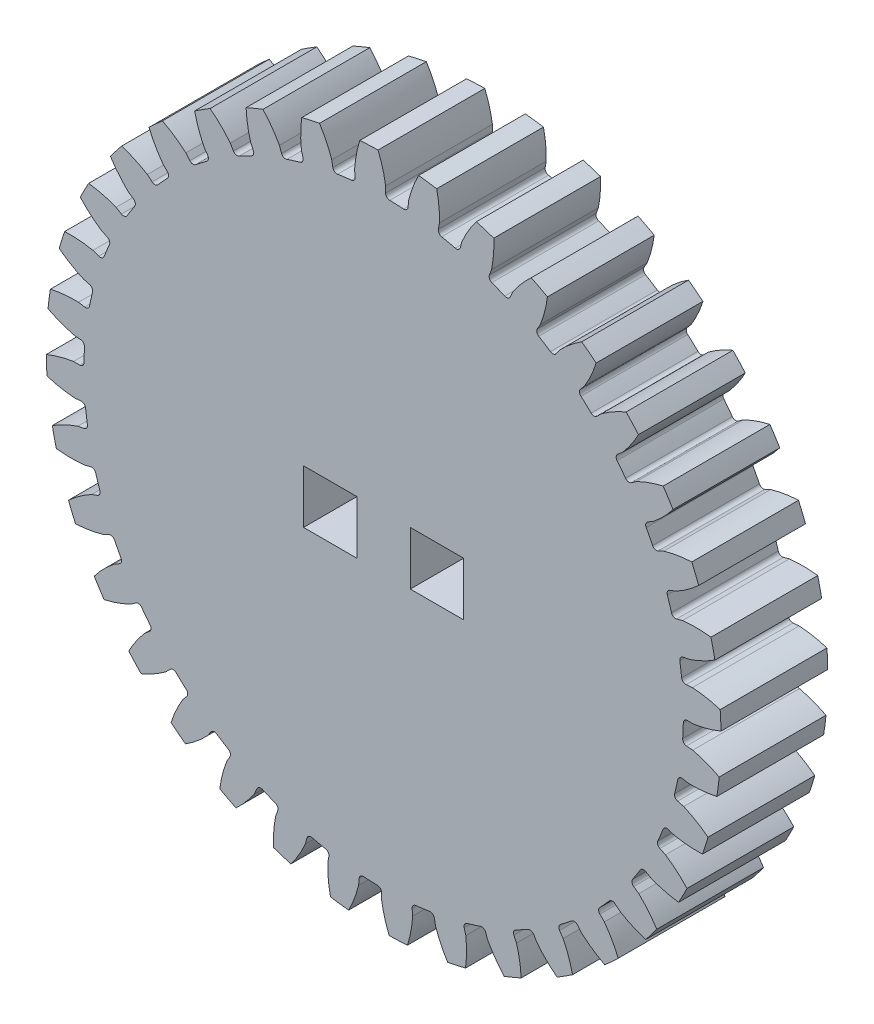
from build123d import *

# Parameters (mm, degrees)
SKETCH1_R                = 20.066
BOSS_EXTRUDE1_DEPTH      = 6.35
CUT_EXTRUDE1_DEPTH       = 30.079394973
FILLET1_R                = 0.2493645
CIRPATTERN1_COUNT        = 36
FILLET1_OF_CIRPATTERN1_R = 0.2493645
CUT_EXTRUDE2_DEPTH       = 30.07560404
CUT_EXTRUDE2_DEPTH_BACK  = 30.07560404
SKETCH6_W                = 3.175
SKETCH6_H                = 3.175


with BuildPart() as part:
    # Sketch1 → Boss-Extrude1 (new body)
    with BuildSketch(Plane.XY):
        Circle(SKETCH1_R)
    extrude(amount=-BOSS_EXTRUDE1_DEPTH)

    # Sketch4 → Cut-Extrude1 (cut, through all)
    with BuildSketch(Plane.XY):
        with BuildLine():
            Line((0.119863022, 18.442823048), (0.119863022, 17.825105335))
            ThreePointArc((0.119863022, 17.825105335), (0.77753957, 17.80854232), (1.434157013, 17.767721886))
            Line((1.434157013, 17.767721886), (1.487994785, 18.383088986))
            add(Edge.make_bspline(
                [(3.588260473, 21.933290983), (1.978189723, 20.400079012), (1.487994785, 18.383088986)],
                knots=[0, 0, 0, 1, 1, 1], degree=2))
            ThreePointArc((3.588260473, 21.933290983), (0.969437499, 22.2037172), (-1.662989269, 22.162566035))
            add(Edge.make_bspline(
                [(-1.662989269, 22.162566035), (-0.192673894, 20.494861186), (0.119863022, 18.442823048)],
                knots=[0, 0, 0, 1, 1, 1], degree=2))
        make_face()
    cut_extrude1 = extrude(amount=-CUT_EXTRUDE1_DEPTH, mode=Mode.SUBTRACT)

    # Fillet1
    fillet1_edges = [part.edges().sort_by_distance(p)[0] for p in [
        (1.434157013, 17.767721886, -3.175),
        (0.119863022, 17.825105335, -3.175),
    ]]
    fillet(fillet1_edges, radius=FILLET1_R)

    # CirPattern1: Cut-Extrude1 ×36 about axis
    cirpattern1_axis = Axis((0, 0, -6.35), (0, 0, 1))
    for i in range(1, CIRPATTERN1_COUNT):
        add(cut_extrude1.rotate(cirpattern1_axis, i * 360 / CIRPATTERN1_COUNT), mode=Mode.SUBTRACT)

    # Fillet1 of CirPattern1
    fillet1_of_cirpattern1_edges = [part.edges().sort_by_distance(p)[0] for p in [
        (-1.672963581, 17.746829018, -3.175),
        (-2.977255024, 17.575115927, -3.175),
        (-4.729252023, 17.186707731, -3.175),
        (-5.983910684, 16.791115516, -3.175),
        (-7.641844536, 16.104377027, -3.175),
        (-8.808748245, 15.496925556, -3.175),
        (-10.32224347, 14.532722976, -3.175),
        (-11.365936448, 13.731869355, -3.175),
        (-12.689006259, 12.519499491, -3.175),
        (-13.577776424, 11.549577253, -3.175),
        (-14.670220014, 10.125877349, -3.175),
        (-15.377062534, 9.01635709, -3.175),
        (-16.205686557, 7.424585548, -3.175),
        (-16.70912438, 6.209179479, -3.175),
        (-17.248751514, 4.497701473, -3.175),
        (-17.533487937, 3.213339092, -3.175),
        (-17.767721886, 1.434157013, -3.175),
        (-17.825105335, 0.119863022, -3.175),
        (-17.746829018, -1.672963581, -3.175),
        (-17.575115927, -2.977255024, -3.175),
        (-17.186707731, -4.729252023, -3.175),
        (-16.791115516, -5.983910684, -3.175),
        (-16.104377027, -7.641844536, -3.175),
        (-15.496925556, -8.808748245, -3.175),
        (-14.532722976, -10.32224347, -3.175),
        (-13.731869355, -11.365936448, -3.175),
        (-12.519499491, -12.689006259, -3.175),
        (-11.549577253, -13.577776424, -3.175),
        (-10.125877349, -14.670220014, -3.175),
        (-9.01635709, -15.377062534, -3.175),
        (-7.424585548, -16.205686557, -3.175),
        (-6.209179479, -16.70912438, -3.175),
        (-4.497701473, -17.248751514, -3.175),
        (-3.213339092, -17.533487937, -3.175),
        (-1.434157013, -17.767721886, -3.175),
        (-0.119863022, -17.825105335, -3.175),
        (1.672963581, -17.746829018, -3.175),
        (2.977255024, -17.575115927, -3.175),
        (4.729252023, -17.186707731, -3.175),
        (5.983910684, -16.791115516, -3.175),
        (7.641844536, -16.104377027, -3.175),
        (8.808748245, -15.496925556, -3.175),
        (10.32224347, -14.532722976, -3.175),
        (11.365936448, -13.731869355, -3.175),
        (12.689006259, -12.519499491, -3.175),
        (13.577776424, -11.549577253, -3.175),
        (14.670220014, -10.125877349, -3.175),
        (15.377062534, -9.01635709, -3.175),
        (16.205686557, -7.424585548, -3.175),
        (16.70912438, -6.209179479, -3.175),
        (17.248751514, -4.497701473, -3.175),
        (17.533487937, -3.213339092, -3.175),
        (17.767721886, -1.434157013, -3.175),
        (17.825105335, -0.119863022, -3.175),
        (17.746829018, 1.672963581, -3.175),
        (17.575115927, 2.977255024, -3.175),
        (17.186707731, 4.729252023, -3.175),
        (16.791115516, 5.983910684, -3.175),
        (16.104377027, 7.641844536, -3.175),
        (15.496925556, 8.808748245, -3.175),
        (14.532722976, 10.32224347, -3.175),
        (13.731869355, 11.365936448, -3.175),
        (12.519499491, 12.689006259, -3.175),
        (11.549577253, 13.577776424, -3.175),
        (10.125877349, 14.670220014, -3.175),
        (9.01635709, 15.377062534, -3.175),
        (7.424585548, 16.205686557, -3.175),
        (6.209179479, 16.70912438, -3.175),
        (4.497701473, 17.248751514, -3.175),
        (3.213339092, 17.533487937, -3.175),
    ]]
    fillet(fillet1_of_cirpattern1_edges, radius=FILLET1_OF_CIRPATTERN1_R)

    # Sketch6 → Cut-Extrude2 (cut, two sides: drawn at the far end of the back side and taken through both)
    with BuildSketch(Plane.XY.offset(-CUT_EXTRUDE2_DEPTH_BACK)):
        with Locations((3.175, 0)):
            Rectangle(SKETCH6_W, SKETCH6_H)
        with Locations((-3.175, 0)):
            Rectangle(SKETCH6_W, SKETCH6_H)
    extrude(amount=CUT_EXTRUDE2_DEPTH + CUT_EXTRUDE2_DEPTH_BACK, mode=Mode.SUBTRACT)


solid = part.part
